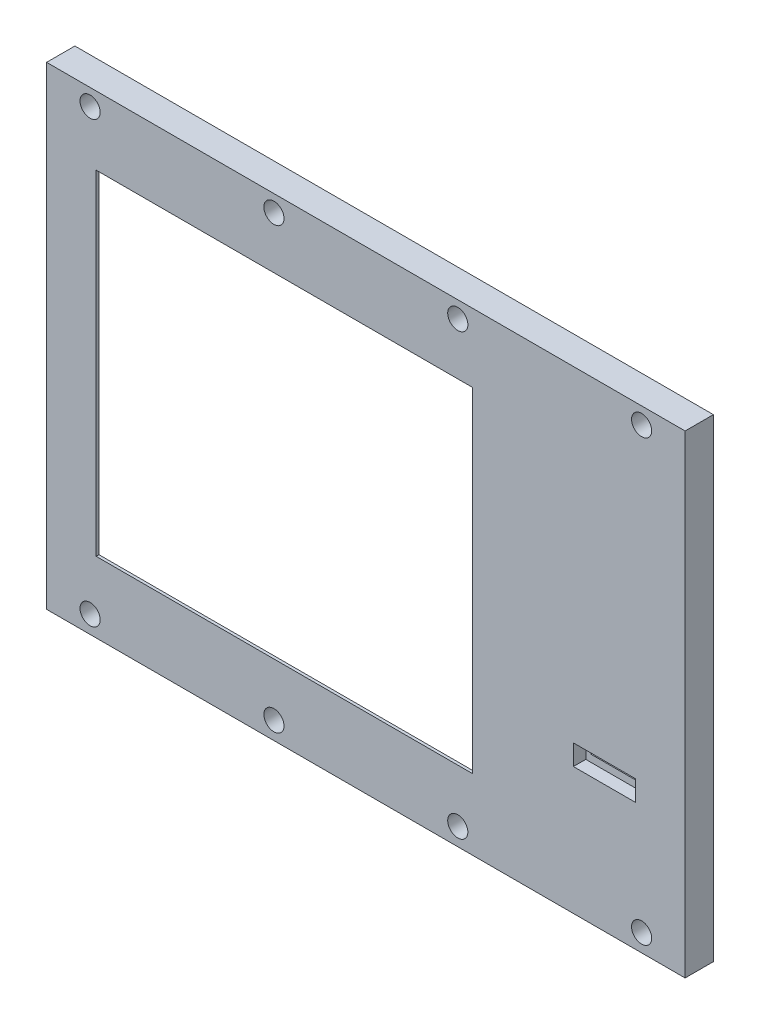
from build123d import *
from OCP.BRepFilletAPI import BRepFilletAPI_MakeChamfer

# Parameters (mm, degrees)
SKETCH1_W               = 180.6
SKETCH1_H               = 134
BOSS_EXTRUDE1_DEPTH     = 0.8
SKETCH1_3_W             = 180.6
SKETCH1_3_H             = 134
SKETCH1_3_W_2           = 172.6
SKETCH1_3_H_2           = 114.6
BOSS_EXTRUDE2_DEPTH     = 16
BOSS_EXTRUDE3_START     = 15.2
BOSS_EXTRUDE3_OUTLINE_W = 172.6
BOSS_EXTRUDE3_OUTLINE_H = 114.6
BOSS_EXTRUDE3_DEPTH     = 0.8
SKETCH2_R               = 1.75
CUT_EXTRUDE1_DEPTH      = 262.731099587
SKETCH3_R               = 2.85
CUT_EXTRUDE2_DEPTH      = 5.8
SKETCH6_R               = 3.95
BOSS_EXTRUDE4_DEPTH     = 3
SKETCH6_3_R             = 3.95
BOSS_EXTRUDE5_DEPTH     = 0.5
SKETCH7_R               = 3.95
BOSS_EXTRUDE6_DEPTH     = 2.5
SKETCH8_R               = 2.5
CUT_EXTRUDE3_DEPTH      = 4
CUT_EXTRUDE4_DEPTH      = 262.683412716
SKETCH9_W               = 17.6
SKETCH9_H               = 5.8
CUT_EXTRUDE5_DEPTH      = 262.683412716
BOSS_EXTRUDE7_START     = -0.8
SKETCH10_W              = 17.6
SKETCH10_H              = 5.8
BOSS_EXTRUDE7_DEPTH     = 4.5
BOSS_EXTRUDE11_START    = -0.8
SKETCH10_4_W            = 1.5
SKETCH10_4_H            = 10
SKETCH10_4_W_2          = 12
SKETCH10_4_H_2          = 1.5
BOSS_EXTRUDE11_DEPTH    = 4.5
SKETCH12_W              = 17.6
SKETCH12_H              = 5.8
SKETCH12_W_2            = 14.6
SKETCH12_H_2            = 2.8
BOSS_EXTRUDE12_DEPTH    = 1
CHAMFER1_SIZE           = 3.7
CHAMFER1_SIZE_2         = 10
FILLET1_R               = 1.5
SKETCH13_W              = 106.5
SKETCH13_H              = 94.6
CUT_EXTRUDE6_DEPTH      = 262.340789948


with BuildPart() as part:
    # Sketch1 → Boss-Extrude1 (new body)
    with BuildSketch(Plane.XY):
        with Locations((162, 0.763400821)):
            Rectangle(SKETCH1_W, SKETCH1_H)
    extrude(amount=BOSS_EXTRUDE1_DEPTH)

    # Sketch1<3> → Boss-Extrude2 (add)
    with BuildSketch(Plane.XY):
        with Locations((162, 0.763400821)):
            Rectangle(SKETCH1_3_W, SKETCH1_3_H)
        with Locations((162, 1.063400821)):
            Rectangle(SKETCH1_3_W_2, SKETCH1_3_H_2, mode=Mode.SUBTRACT)
    extrude(amount=BOSS_EXTRUDE2_DEPTH)

    # Boss-Extrude3: read off the stored shape, not the designer's step
    # Boss-Extrude3 outline → Boss-Extrude3 (add)
    with BuildSketch(Plane.XY.offset(BOSS_EXTRUDE3_START)):
        with Locations((162, 1.063400821)):
            Rectangle(BOSS_EXTRUDE3_OUTLINE_W, BOSS_EXTRUDE3_OUTLINE_H)
    extrude(amount=BOSS_EXTRUDE3_DEPTH)

    # Sketch2 → Cut-Extrude1 (cut, through all)
    with BuildSketch(Plane(origin=(0, 0, 0), x_dir=(-1, 0, 0), z_dir=(0, 0, -1))):
        with Locations((-84, -61.236599179)):
            Circle(SKETCH2_R)
        with Locations((-136, -61.236599179)):
            Circle(SKETCH2_R)
        with Locations((-188, -61.236599179)):
            Circle(SKETCH2_R)
        with Locations((-240, -61.236599179)):
            Circle(SKETCH2_R)
        with Locations((-84, 63.063400821)):
            Circle(SKETCH2_R)
        with Locations((-136, 63.063400821)):
            Circle(SKETCH2_R)
        with Locations((-188, 63.063400821)):
            Circle(SKETCH2_R)
        with Locations((-240, 63.063400821)):
            Circle(SKETCH2_R)
    extrude(amount=-CUT_EXTRUDE1_DEPTH, mode=Mode.SUBTRACT)

    # Sketch3 → Cut-Extrude2 (cut)
    with BuildSketch(Plane.XY.offset(16)):
        with Locations((84, -61.236599179)):
            Circle(SKETCH3_R)
        with Locations((136, -61.236599179)):
            Circle(SKETCH3_R)
        with Locations((188, -61.236599179)):
            Circle(SKETCH3_R)
        with Locations((240, -61.236599179)):
            Circle(SKETCH3_R)
        with Locations((240, 63.063400821)):
            Circle(SKETCH3_R)
        with Locations((188, 63.063400821)):
            Circle(SKETCH3_R)
        with Locations((136, 63.063400821)):
            Circle(SKETCH3_R)
        with Locations((84, 63.063400821)):
            Circle(SKETCH3_R)
    extrude(amount=-CUT_EXTRUDE2_DEPTH, mode=Mode.SUBTRACT)

    # Sketch6 → Boss-Extrude4 (add)
    # profile 1 of 4: a face of its own
    with BuildSketch(Plane.XY.offset(0.8)):
        with Locations((88.75, 36.95)):
            Circle(SKETCH6_R)
        Polygon((91.5, 35.36228676), (91.5, 38.53771324), (88.75, 40.125426481), (86, 38.53771324), (86, 35.36228676), (88.75, 33.774573519), align=None, mode=Mode.SUBTRACT)
    # profile 2 of 4: a face of its own
    with BuildSketch(Plane.XY.offset(0.8)):
        with Locations((88.75, -36.95)):
            Circle(SKETCH6_R)
        Polygon((91.5, -35.36228676), (88.75, -33.774573519), (86, -35.36228676), (86, -38.53771324), (88.75, -40.125426481), (91.5, -38.53771324), align=None, mode=Mode.SUBTRACT)
    # profile 3 of 4: a face of its own
    with BuildSketch(Plane.XY.offset(0.8)):
        with Locations((202.65, -36.95)):
            Circle(SKETCH6_R)
        Polygon((205.4, -38.53771324), (205.4, -35.36228676), (202.65, -33.774573519), (199.9, -35.36228676), (199.9, -38.53771324), (202.65, -40.125426481), align=None, mode=Mode.SUBTRACT)
    # profile 4 of 4: a face of its own
    with BuildSketch(Plane.XY.offset(0.8)):
        with Locations((202.65, 36.95)):
            Circle(SKETCH6_R)
        Polygon((205.4, 35.36228676), (205.4, 38.53771324), (202.65, 40.125426481), (199.9, 38.53771324), (199.9, 35.36228676), (202.65, 33.774573519), align=None, mode=Mode.SUBTRACT)
    extrude(amount=BOSS_EXTRUDE4_DEPTH)

    # Sketch6<3> → Boss-Extrude5 (add)
    with BuildSketch(Plane.XY.offset(0.8)):
        Polygon((86, 35.36228676), (88.75, 33.774573519), (91.5, 35.36228676), (91.5, 38.53771324), (88.75, 40.125426481), (86, 38.53771324), align=None)
        Polygon((199.9, 35.36228676), (202.65, 33.774573519), (205.4, 35.36228676), (205.4, 38.53771324), (202.65, 40.125426481), (199.9, 38.53771324), align=None)
        Polygon((199.9, -38.53771324), (202.65, -40.125426481), (205.4, -38.53771324), (205.4, -35.36228676), (202.65, -33.774573519), (199.9, -35.36228676), align=None)
        Polygon((88.75, -40.125426481), (91.5, -38.53771324), (91.5, -35.36228676), (88.75, -33.774573519), (86, -35.36228676), (86, -38.53771324), align=None)
        with Locations((88.75, 36.95)):
            Circle(SKETCH6_3_R)
    extrude(amount=BOSS_EXTRUDE5_DEPTH)

    # Sketch7 → Boss-Extrude6 (add)
    # profile 1 of 2: a face of its own
    with BuildSketch(Plane.XY.offset(0.8)):
        with Locations((218.5, 4)):
            Circle(SKETCH7_R)
        Polygon((220.08771324, 6.75), (216.91228676, 6.75), (215.324573519, 4), (216.91228676, 1.25), (220.08771324, 1.25), (221.675426481, 4), align=None, mode=Mode.SUBTRACT)
    # profile 2 of 2: a face of its own
    with BuildSketch(Plane.XY.offset(0.8)):
        with Locations((233.4, 33.2)):
            Circle(SKETCH7_R)
        Polygon((234.98771324, 35.95), (231.81228676, 35.95), (230.224573519, 33.2), (231.81228676, 30.45), (234.98771324, 30.45), (236.575426481, 33.2), align=None, mode=Mode.SUBTRACT)
    extrude(amount=BOSS_EXTRUDE6_DEPTH)

    # Sketch8 → Cut-Extrude3 (cut)
    with BuildSketch(Plane.ZY.offset(-71.7)):
        with Locations(Location((8, 0, 0), (0, 0, 270))):
            Circle(SKETCH8_R)
    extrude(amount=-CUT_EXTRUDE3_DEPTH, mode=Mode.SUBTRACT)

    # Sketch4 → Cut-Extrude4 (cut, through all)
    with BuildSketch(Plane.XY.offset(0.8)):
        with BuildLine():
            Line((188.3, -41.236599179), (178.3, -41.236599179))
            ThreePointArc((178.3, -41.236599179), (173.3, -46.236599179), (178.3, -51.236599179))
            Line((178.3, -51.236599179), (188.3, -51.236599179))
            ThreePointArc((188.3, -51.236599179), (193.3, -46.236599179), (188.3, -41.236599179))
        make_face()
    extrude(amount=-CUT_EXTRUDE4_DEPTH, mode=Mode.SUBTRACT)

    # Sketch9 → Cut-Extrude5 (cut, through all)
    with BuildSketch(Plane(origin=(0, 0, 15.2), x_dir=(-1, 0, 0), z_dir=(0, 0, -1))):
        with Locations((-229.5, -27.336599179)):
            Rectangle(SKETCH9_W, SKETCH9_H)
    extrude(amount=-CUT_EXTRUDE5_DEPTH, mode=Mode.SUBTRACT)

    # Sketch10 → Boss-Extrude7 (add)
    with BuildSketch(Plane(origin=(0, 0, 15.2), x_dir=(-1, 0, 0), z_dir=(0, 0, -1)).offset(BOSS_EXTRUDE7_START)):
        Polygon((-220.7, -31.736599179), (-219.2, -31.736599179), (-219.2, -30.236599179), (-219.2, -24.436599179), (-219.2, -22.936599179), (-220.7, -22.936599179), (-227.795416498, -22.936599179), (-229.295416498, -22.936599179), (-237.890832997, -22.936599179), (-248.3, -18.489964731), (-248.3, -20.121097705), (-239.8, -23.752165666), (-239.8, -30.921032692), (-248.3, -34.552100653), (-248.3, -36.183233627), (-237.890832997, -31.736599179), (-229.295416498, -31.736599179), (-227.795416498, -31.736599179), align=None)
        with Locations((-229.5, -27.336599179)):
            Rectangle(SKETCH10_W, SKETCH10_H, mode=Mode.SUBTRACT)
    extrude(amount=BOSS_EXTRUDE7_DEPTH)

    # Sketch10<4> → Boss-Extrude11 (add)
    with BuildSketch(Plane(origin=(0, 0, 15.2), x_dir=(-1, 0, 0), z_dir=(0, 0, -1)).offset(BOSS_EXTRUDE11_START)):
        with Locations((-228.545416498, -17.936599179)):
            Rectangle(SKETCH10_4_W, SKETCH10_4_H)
        with Locations((-219.95, -17.936599179)):
            Rectangle(SKETCH10_4_W, SKETCH10_4_H)
        with Locations((-228.545416498, -36.736599179)):
            Rectangle(SKETCH10_4_W, SKETCH10_4_H)
        with Locations((-219.95, -36.736599179)):
            Rectangle(SKETCH10_4_W, SKETCH10_4_H)
        with Locations((-213.2, -30.986599179)):
            Rectangle(SKETCH10_4_W_2, SKETCH10_4_H_2)
        with Locations((-213.2, -23.686599179)):
            Rectangle(SKETCH10_4_W_2, SKETCH10_4_H_2)
    extrude(amount=BOSS_EXTRUDE11_DEPTH)

    # Sketch12 → Boss-Extrude12 (add)
    with BuildSketch(Plane(origin=(0, 0, 11.5), x_dir=(-1, 0, 0), z_dir=(0, 0, -1))):
        with Locations((-229.5, -27.336599179)):
            Rectangle(SKETCH12_W, SKETCH12_H)
        with Locations((-229.5, -26.836599179)):
            Rectangle(SKETCH12_W_2, SKETCH12_H_2, mode=Mode.SUBTRACT)
    extrude(amount=-BOSS_EXTRUDE12_DEPTH)

    # Chamfer1
    chamfer1_edges_1 = [part.edges().sort_by_distance(p)[0] for p in [
        (228.545416498, -12.936599179, 11.5),
    ]]
    chamfer1_side_1 = [part.faces().sort_by_distance(p)[0] for p in [
        (228.545416498, -12.936599179, 11.574),
    ]]
    chamfer1_edges_2 = [part.edges().sort_by_distance(p)[0] for p in [
        (219.95, -12.936599179, 11.5),
    ]]
    chamfer1_side_2 = [part.faces().sort_by_distance(p)[0] for p in [
        (219.95, -12.936599179, 11.574),
    ]]
    chamfer1_edges_3 = [part.edges().sort_by_distance(p)[0] for p in [
        (207.2, -23.686599179, 11.5),
    ]]
    chamfer1_side_3 = [part.faces().sort_by_distance(p)[0] for p in [
        (207.2, -23.686599179, 11.574),
    ]]
    chamfer1_edges_4 = [part.edges().sort_by_distance(p)[0] for p in [
        (207.2, -30.986599179, 11.5),
    ]]
    chamfer1_side_4 = [part.faces().sort_by_distance(p)[0] for p in [
        (207.2, -30.986599179, 11.574),
    ]]
    chamfer1_edges_5 = [part.edges().sort_by_distance(p)[0] for p in [
        (219.95, -41.736599179, 11.5),
    ]]
    chamfer1_side_5 = [part.faces().sort_by_distance(p)[0] for p in [
        (219.95, -41.736599179, 11.574),
    ]]
    chamfer1_edges_6 = [part.edges().sort_by_distance(p)[0] for p in [
        (228.545416498, -41.736599179, 11.5),
    ]]
    chamfer1_side_6 = [part.faces().sort_by_distance(p)[0] for p in [
        (228.545416498, -41.736599179, 11.574),
    ]]
    chamfer1 = BRepFilletAPI_MakeChamfer(part.part.solid().wrapped)
    for e in chamfer1_edges_1:
        chamfer1.Add(CHAMFER1_SIZE - 0.0001, CHAMFER1_SIZE_2 - 0.0001, e.wrapped, chamfer1_side_1[0].wrapped)
    for e in chamfer1_edges_2:
        chamfer1.Add(CHAMFER1_SIZE - 0.0001, CHAMFER1_SIZE_2 - 0.0001, e.wrapped, chamfer1_side_2[0].wrapped)
    for e in chamfer1_edges_3:
        chamfer1.Add(CHAMFER1_SIZE - 0.0001, CHAMFER1_SIZE_2 - 0.0001, e.wrapped, chamfer1_side_3[0].wrapped)
    for e in chamfer1_edges_4:
        chamfer1.Add(CHAMFER1_SIZE - 0.0001, CHAMFER1_SIZE_2 - 0.0001, e.wrapped, chamfer1_side_4[0].wrapped)
    for e in chamfer1_edges_5:
        chamfer1.Add(CHAMFER1_SIZE - 0.0001, CHAMFER1_SIZE_2 - 0.0001, e.wrapped, chamfer1_side_5[0].wrapped)
    for e in chamfer1_edges_6:
        chamfer1.Add(CHAMFER1_SIZE - 0.0001, CHAMFER1_SIZE_2 - 0.0001, e.wrapped, chamfer1_side_6[0].wrapped)
    add(Compound.cast(chamfer1.Shape()), mode=Mode.REPLACE)  # a hair under: the kernel refuses the full size

    # Fillet1
    # the kernel refuses this fillet: 1.5 mm, written as the material it adds along each edge
    with BuildSketch(Plane(origin=(246.8, -32.28019098, 13.7), x_dir=(-0.39284148462788226, -0.9196062026516358, 0), z_dir=(0, 0, 1))) as fillet1_piece_1_section:
        Polygon((0, 0), (FILLET1_R * 1.02, 0), (FILLET1_R * 1.02, FILLET1_R * 1.54489857748), (-FILLET1_R * 0.40069831432, FILLET1_R * 0.937998326705), align=None)
    fillet1_piece_1 = extrude(amount=FILLET1_R * 1.02, mode=Mode.PRIVATE)
    fillet1_piece_1 = fillet1_piece_1 - Plane(origin=(246.8, -32.28019098, 13.7), x_dir=(-0.5509802697792897, 0.8345182696106427, 0), z_dir=(0, 0, 1)) * Sphere(FILLET1_R, mode=Mode.PRIVATE)
    add(fillet1_piece_1)
    with BuildSketch(Plane(origin=(246.8, -22.393007377, 13.7), x_dir=(-0.39284148462788226, 0.9196062026516358, 0), z_dir=(0, 0, 1))) as fillet1_piece_2_section:
        Polygon((0, 0), (FILLET1_R * 1.02, 0), (FILLET1_R * 1.02, -FILLET1_R * 1.54489857748), (-FILLET1_R * 0.40069831432, -FILLET1_R * 0.937998326705), align=None)
    fillet1_piece_2 = extrude(amount=FILLET1_R * 1.02, mode=Mode.PRIVATE)
    fillet1_piece_2 = fillet1_piece_2 - Plane(origin=(246.8, -22.393007377, 13.7), x_dir=(-0.5509802697792897, -0.8345182696106427, 0), z_dir=(0, 0, 1)) * Sphere(FILLET1_R, mode=Mode.PRIVATE)
    add(fillet1_piece_2)
    with BuildSketch(Plane(origin=(237.583862626, -21.436599179, 13.7), x_dir=(0.39284148462788177, -0.919606202651636, 0), z_dir=(0, 0, 1))) as fillet1_piece_3_section:
        Polygon((0, 0), (FILLET1_R * 1.02, 0), (FILLET1_R * 1.02, -FILLET1_R * 0.208739851834), (FILLET1_R * 0.937998326705, -FILLET1_R * 0.40069831432), align=None)
    fillet1_piece_3 = extrude(amount=FILLET1_R * 1.02, mode=Mode.PRIVATE)
    fillet1_piece_3 = fillet1_piece_3 - Plane(origin=(237.583862626, -21.436599179, 13.7), x_dir=(-0.20049164240481954, 0.9796954125266781, 0), z_dir=(0, 0, 1)) * Sphere(FILLET1_R, mode=Mode.PRIVATE)
    add(fillet1_piece_3)
    with BuildSketch(Plane(origin=(237.583862626, -33.236599179, 13.7), x_dir=(0, 1, 0), z_dir=(0, 0, 1))) as fillet1_piece_4_section:
        Polygon((0, 0), (FILLET1_R * 1.02, 0), (FILLET1_R * 1.02, -FILLET1_R * 0.208739851834), (FILLET1_R * 0.937998326705, -FILLET1_R * 0.40069831432), align=None)
    fillet1_piece_4 = extrude(amount=FILLET1_R * 1.02, mode=Mode.PRIVATE)
    fillet1_piece_4 = fillet1_piece_4 - Plane(origin=(237.583862626, -33.236599179, 13.7), x_dir=(-0.2004916424048197, -0.9796954125266781, 0), z_dir=(0, 0, 1)) * Sphere(FILLET1_R, mode=Mode.PRIVATE)
    add(fillet1_piece_4)
    with BuildSketch(Plane(origin=(248.3, -14.739964731, 11.5), x_dir=(-1, 0, 0), z_dir=(0, -1, 0))) as fillet1_piece_5_section:
        with BuildLine():
            CenterArc((FILLET1_R, FILLET1_R), FILLET1_R, 180, 90)
            Line((0, FILLET1_R), (0, 0))
            Line((0, 0), (FILLET1_R, 0))
        make_face()
    fillet1_piece_5 = extrude(amount=9.131132974, mode=Mode.PRIVATE)
    fillet1_piece_5 = split(fillet1_piece_5, bisect_by=Plane(origin=(250.243985224, -19.290657415, 11.5), z_dir=(-0.39284148462788226, 0.9196062026516358, 0)), keep=Keep.TOP, mode=Mode.PRIVATE)
    fillet1_piece_5 = split(fillet1_piece_5, bisect_by=Plane(origin=(249.654722997, -17.911248111, 11.5), z_dir=(0.39284148462788177, -0.919606202651636, 0)), keep=Keep.TOP, mode=Mode.PRIVATE)
    add(fillet1_piece_5)
    with BuildSketch(Plane(origin=(248.3, -30.802100653, 11.5), x_dir=(-1, 0, 0), z_dir=(0, -1, 0))) as fillet1_piece_6_section:
        with BuildLine():
            CenterArc((FILLET1_R, FILLET1_R), FILLET1_R, 180, 90)
            Line((0, FILLET1_R), (0, 0))
            Line((0, 0), (FILLET1_R, 0))
        make_face()
    fillet1_piece_6 = extrude(amount=9.131132974, mode=Mode.PRIVATE)
    fillet1_piece_6 = split(fillet1_piece_6, bisect_by=Plane(origin=(246.356014776, -35.352793337, 11.5), z_dir=(0.3928414846278821, 0.919606202651636, 0)), keep=Keep.TOP, mode=Mode.PRIVATE)
    fillet1_piece_6 = split(fillet1_piece_6, bisect_by=Plane(origin=(246.945277003, -33.973384033, 11.5), z_dir=(-0.39284148462788226, -0.9196062026516358, 0)), keep=Keep.TOP, mode=Mode.PRIVATE)
    add(fillet1_piece_6)
    with BuildSketch(Plane(origin=(248.3, -36.183233627, 17.675890687), x_dir=(-0.9196062026516343, 0.39284148462788554, 0), z_dir=(0, 0, -1))) as fillet1_piece_7_section:
        with BuildLine():
            CenterArc((FILLET1_R * 0.660237516473, -FILLET1_R), FILLET1_R, 90, 66.868579185)
            Line((-FILLET1_R * 0.259368686178, -FILLET1_R * 0.607158515372), (0, 0))
            Line((0, 0), (FILLET1_R * 0.660237516473, 0))
        make_face()
    fillet1_piece_7 = extrude(amount=6.175890687, mode=Mode.PRIVATE)
    fillet1_piece_7 = split(fillet1_piece_7, bisect_by=Plane(origin=(248.3, -36.183233627, 16), z_dir=(0, 0, -1)), keep=Keep.TOP, mode=Mode.PRIVATE)
    add(fillet1_piece_7)
    with BuildSketch(Plane(origin=(248.3, -32.28019098, 15.2), x_dir=(0, 0, -1), z_dir=(0, 1, 0))) as fillet1_piece_8:
        with BuildLine():
            CenterArc((FILLET1_R, FILLET1_R), FILLET1_R, 180, 90)
            Line((0, FILLET1_R), (0, 0))
            Line((0, 0), (FILLET1_R, 0))
        make_face()
    extrude(amount=9.887183603)
    with BuildSketch(Plane(origin=(248.3, -20.121097705, 13.7), x_dir=(0, -1, 0), z_dir=(0, 0, -1))) as fillet1_piece_9:
        with BuildLine():
            CenterArc((FILLET1_R * 1.51460644851, FILLET1_R), FILLET1_R, 156.868579185, 113.131420815)
            Line((FILLET1_R * 0.59500024586, FILLET1_R * 1.39284148463), (0, 0))
            Line((0, 0), (FILLET1_R * 1.51460644851, 0))
        make_face()
    extrude(amount=2.2)
    with BuildSketch(Plane(origin=(246.210737773, -21.013598073, 15.2), x_dir=(0, 0, -1), z_dir=(-0.9196062026516358, -0.39284148462788226, 0))) as fillet1_piece_10_section:
        with BuildLine():
            CenterArc((FILLET1_R, FILLET1_R), FILLET1_R, 180, 90)
            Line((0, FILLET1_R), (0, 0))
            Line((0, 0), (FILLET1_R, 0))
        make_face()
    fillet1_piece_10 = extrude(amount=10.721177178, mode=Mode.PRIVATE)
    fillet1_piece_10 = split(fillet1_piece_10, bisect_by=Plane(origin=(238.3, -21.013598073, 15.2), z_dir=(1, 0, 0)), keep=Keep.TOP, mode=Mode.PRIVATE)
    add(fillet1_piece_10)
    with BuildSketch(Plane(origin=(239.8, -20.002165666, 15.2), x_dir=(0, 0, -1), z_dir=(0, -1, 0))) as fillet1_piece_11_section:
        with BuildLine():
            CenterArc((FILLET1_R, FILLET1_R), FILLET1_R, 180, 90)
            Line((0, FILLET1_R), (0, 0))
            Line((0, 0), (FILLET1_R, 0))
        make_face()
    fillet1_piece_11 = extrude(amount=14.668867026, mode=Mode.PRIVATE)
    fillet1_piece_11 = split(fillet1_piece_11, bisect_by=Plane(origin=(235.85545593, -29.23598474, 15.2), z_dir=(0.39284148462788226, 0.9196062026516358, 0)), keep=Keep.TOP, mode=Mode.PRIVATE)
    fillet1_piece_11 = split(fillet1_piece_11, bisect_by=Plane(origin=(240.56546077, -21.794039742, 15.2), z_dir=(0.39284148462788177, -0.919606202651636, 0)), keep=Keep.TOP, mode=Mode.PRIVATE)
    add(fillet1_piece_11)
    with BuildSketch(Plane(origin=(248.3, -34.552100653, 13.7), x_dir=(0, 1, 0), z_dir=(0, 0, -1))) as fillet1_piece_12:
        with BuildLine():
            CenterArc((FILLET1_R * 1.51460644851, -FILLET1_R), FILLET1_R, 90, 113.131420815)
            Line((FILLET1_R * 0.59500024586, -FILLET1_R * 1.39284148463), (0, 0))
            Line((0, 0), (FILLET1_R * 1.51460644851, 0))
        make_face()
    extrude(amount=2.2)
    with BuildSketch(Plane(origin=(236.35147674, -29.447877125, 15.2), x_dir=(0, 0, -1), z_dir=(0.9196062026516358, -0.39284148462788226, 0))) as fillet1_piece_13_section:
        with BuildLine():
            CenterArc((FILLET1_R, FILLET1_R), FILLET1_R, 180, 90)
            Line((0, FILLET1_R), (0, 0))
            Line((0, 0), (FILLET1_R, 0))
        make_face()
    fillet1_piece_13 = extrude(amount=10.721177178, mode=Mode.PRIVATE)
    fillet1_piece_13 = split(fillet1_piece_13, bisect_by=Plane(origin=(238.3, -29.447877125, 15.2), z_dir=(1, 0, 0)), keep=Keep.TOP, mode=Mode.PRIVATE)
    add(fillet1_piece_13)
    with BuildSketch(Plane(origin=(248.3, -18.489964731, 17.675890687), x_dir=(0, 1, 0), z_dir=(0, 0, -1))) as fillet1_piece_14_section:
        with BuildLine():
            CenterArc((FILLET1_R * 0.660237516473, -FILLET1_R), FILLET1_R, 90, 66.868579185)
            Line((-FILLET1_R * 0.259368686178, -FILLET1_R * 0.607158515372), (0, 0))
            Line((0, 0), (FILLET1_R * 0.660237516473, 0))
        make_face()
    fillet1_piece_14 = extrude(amount=6.175890687, mode=Mode.PRIVATE)
    fillet1_piece_14 = split(fillet1_piece_14, bisect_by=Plane(origin=(248.3, -18.489964731, 16), z_dir=(0, 0, -1)), keep=Keep.TOP, mode=Mode.PRIVATE)
    add(fillet1_piece_14)
    with BuildSketch(Plane(origin=(238.173124853, -22.816008483, 15.2), x_dir=(-0.39284148462788177, 0.919606202651636, 0), z_dir=(0.919606202651636, 0.39284148462788177, 0)), Plane(origin=(251.74852326, -37.656389194, 15.2), x_dir=(-0.3928414846278821, -0.9196062026516357, 0), z_dir=(-0.919606202651636, 0.3928414846278821, 0))) as fillet1_piece_15:
        with BuildLine():
            CenterArc((FILLET1_R, -FILLET1_R), FILLET1_R, 90, 90)
            Line((0, -FILLET1_R), (0, 0))
            Line((0, 0), (FILLET1_R, 0))
        make_face()
    extrude(amount=14.762186649)
    with BuildSketch(Plane(origin=(237.890832997, -22.936599179, 13.7), x_dir=(-1, 0, 0), z_dir=(0, 0, -1))) as fillet1_piece_16:
        with BuildLine():
            CenterArc((FILLET1_R * 0.204646913562, FILLET1_R), FILLET1_R, 246.868579185, 23.131420815)
            Line((-FILLET1_R * 0.188194571065, FILLET1_R * 0.0803937973484), (0, 0))
            Line((0, 0), (FILLET1_R * 0.204646913562, 0))
        make_face()
    extrude(amount=2.2)
    with BuildSketch(Plane(origin=(225.545416498, -22.936599179, 15.2), x_dir=(0, 0, -1), z_dir=(1, 0, 0))) as fillet1_piece_17:
        with BuildLine():
            CenterArc((FILLET1_R, FILLET1_R), FILLET1_R, 180, 90)
            Line((0, FILLET1_R), (0, 0))
            Line((0, 0), (FILLET1_R, 0))
        make_face()
    extrude(amount=12.038446128)
    with BuildSketch(Plane(origin=(229.295416498, -22.936599179, 18.95), x_dir=(0, 1, 0), z_dir=(0, 0, -1))) as fillet1_piece_18_section:
        with BuildLine():
            CenterArc((FILLET1_R, FILLET1_R), FILLET1_R, 180, 90)
            Line((0, FILLET1_R), (0, 0))
            Line((0, 0), (FILLET1_R, 0))
        make_face()
    fillet1_piece_18 = extrude(amount=7.45, mode=Mode.PRIVATE)
    fillet1_piece_18 = split(fillet1_piece_18, bisect_by=Plane(origin=(229.295416498, -20.512042879, 12.397033557), z_dir=(0, -0.3470036846710527, 0.9378637655996274)), keep=Keep.TOP, mode=Mode.PRIVATE)
    fillet1_piece_18 = split(fillet1_piece_18, bisect_by=Plane(origin=(229.295416498, -22.936599179, 16), z_dir=(0, 0, -1)), keep=Keep.TOP, mode=Mode.PRIVATE)
    add(fillet1_piece_18)
    with BuildSketch(Plane(origin=(227.795416498, -22.936599179, 18.95), x_dir=(-1, 0, 0), z_dir=(0, 0, -1))) as fillet1_piece_19_section:
        with BuildLine():
            CenterArc((FILLET1_R, FILLET1_R), FILLET1_R, 180, 90)
            Line((0, FILLET1_R), (0, 0))
            Line((0, 0), (FILLET1_R, 0))
        make_face()
    fillet1_piece_19 = extrude(amount=7.45, mode=Mode.PRIVATE)
    fillet1_piece_19 = split(fillet1_piece_19, bisect_by=Plane(origin=(227.795416498, -20.512042879, 12.397033557), z_dir=(0, -0.3470036846710527, 0.9378637655996274)), keep=Keep.TOP, mode=Mode.PRIVATE)
    fillet1_piece_19 = split(fillet1_piece_19, bisect_by=Plane(origin=(227.795416498, -22.936599179, 16), z_dir=(0, 0, -1)), keep=Keep.TOP, mode=Mode.PRIVATE)
    add(fillet1_piece_19)
    with BuildSketch(Plane(origin=(220.7, -22.936599179, 15.2), x_dir=(0, 1, 0), z_dir=(1, 0, 0))) as fillet1_piece_20:
        with BuildLine():
            CenterArc((FILLET1_R, -FILLET1_R), FILLET1_R, 90, 90)
            Line((0, -FILLET1_R), (0, 0))
            Line((0, 0), (FILLET1_R, 0))
        make_face()
    extrude(amount=10.845416498)
    with BuildSketch(Plane(origin=(220.7, -22.936599179, 18.95), x_dir=(0, 1, 0), z_dir=(0, 0, -1))) as fillet1_piece_21_section:
        with BuildLine():
            CenterArc((FILLET1_R, FILLET1_R), FILLET1_R, 180, 90)
            Line((0, FILLET1_R), (0, 0))
            Line((0, 0), (FILLET1_R, 0))
        make_face()
    fillet1_piece_21 = extrude(amount=7.45, mode=Mode.PRIVATE)
    fillet1_piece_21 = split(fillet1_piece_21, bisect_by=Plane(origin=(220.7, -20.512042879, 12.397033557), z_dir=(0, -0.34700368467105286, 0.9378637655996273)), keep=Keep.TOP, mode=Mode.PRIVATE)
    fillet1_piece_21 = split(fillet1_piece_21, bisect_by=Plane(origin=(220.7, -22.936599179, 16), z_dir=(0, 0, -1)), keep=Keep.TOP, mode=Mode.PRIVATE)
    add(fillet1_piece_21)
    with BuildSketch(Plane(origin=(219.2, -22.936599179, 18.95), x_dir=(-1, 0, 0), z_dir=(0, 0, -1))) as fillet1_piece_22_section:
        with BuildLine():
            CenterArc((FILLET1_R, FILLET1_R), FILLET1_R, 180, 90)
            Line((0, FILLET1_R), (0, 0))
            Line((0, 0), (FILLET1_R, 0))
        make_face()
    fillet1_piece_22 = extrude(amount=7.45, mode=Mode.PRIVATE)
    fillet1_piece_22 = split(fillet1_piece_22, bisect_by=Plane(origin=(219.2, -20.512042879, 12.397033557), z_dir=(0, -0.34700368467105286, 0.9378637655996273)), keep=Keep.TOP, mode=Mode.PRIVATE)
    fillet1_piece_22 = split(fillet1_piece_22, bisect_by=Plane(origin=(219.2, -22.936599179, 16), z_dir=(0, 0, -1)), keep=Keep.TOP, mode=Mode.PRIVATE)
    add(fillet1_piece_22)
    with BuildSketch(Plane(origin=(219.2, -24.436599179, 18.95), x_dir=(0, -1, 0), z_dir=(0, 0, -1))) as fillet1_piece_23_section:
        with BuildLine():
            CenterArc((FILLET1_R, FILLET1_R), FILLET1_R, 180, 90)
            Line((0, FILLET1_R), (0, 0))
            Line((0, 0), (FILLET1_R, 0))
        make_face()
    fillet1_piece_23 = extrude(amount=7.45, mode=Mode.PRIVATE)
    fillet1_piece_23 = split(fillet1_piece_23, bisect_by=Plane(origin=(219.2, -24.436599179, 16), z_dir=(0, 0, -1)), keep=Keep.TOP, mode=Mode.PRIVATE)
    add(fillet1_piece_23)
    with BuildSketch(Plane(origin=(219.2, -30.236599179, 18.95), x_dir=(-1, 0, 0), z_dir=(0, 0, -1))) as fillet1_piece_24_section:
        with BuildLine():
            CenterArc((FILLET1_R, FILLET1_R), FILLET1_R, 180, 90)
            Line((0, FILLET1_R), (0, 0))
            Line((0, 0), (FILLET1_R, 0))
        make_face()
    fillet1_piece_24 = extrude(amount=7.45, mode=Mode.PRIVATE)
    fillet1_piece_24 = split(fillet1_piece_24, bisect_by=Plane(origin=(219.2, -30.236599179, 16), z_dir=(0, 0, -1)), keep=Keep.TOP, mode=Mode.PRIVATE)
    add(fillet1_piece_24)
    with BuildSketch(Plane(origin=(219.2, -31.736599179, 18.95), x_dir=(0, -1, 0), z_dir=(0, 0, -1))) as fillet1_piece_25_section:
        with BuildLine():
            CenterArc((FILLET1_R, FILLET1_R), FILLET1_R, 180, 90)
            Line((0, FILLET1_R), (0, 0))
            Line((0, 0), (FILLET1_R, 0))
        make_face()
    fillet1_piece_25 = extrude(amount=7.45, mode=Mode.PRIVATE)
    fillet1_piece_25 = split(fillet1_piece_25, bisect_by=Plane(origin=(219.2, -34.161155479, 12.397033557), z_dir=(0, 0.34700368467105275, 0.9378637655996273)), keep=Keep.TOP, mode=Mode.PRIVATE)
    fillet1_piece_25 = split(fillet1_piece_25, bisect_by=Plane(origin=(219.2, -31.736599179, 16), z_dir=(0, 0, -1)), keep=Keep.TOP, mode=Mode.PRIVATE)
    add(fillet1_piece_25)
    with BuildSketch(Plane(origin=(220.7, -31.736599179, 18.95), x_dir=(0, -1, 0), z_dir=(0, 0, -1))) as fillet1_piece_26_section:
        with BuildLine():
            CenterArc((FILLET1_R, -FILLET1_R), FILLET1_R, 90, 90)
            Line((0, -FILLET1_R), (0, 0))
            Line((0, 0), (FILLET1_R, 0))
        make_face()
    fillet1_piece_26 = extrude(amount=7.45, mode=Mode.PRIVATE)
    fillet1_piece_26 = split(fillet1_piece_26, bisect_by=Plane(origin=(220.7, -34.161155479, 12.397033557), z_dir=(0, 0.34700368467105275, 0.9378637655996273)), keep=Keep.TOP, mode=Mode.PRIVATE)
    fillet1_piece_26 = split(fillet1_piece_26, bisect_by=Plane(origin=(220.7, -31.736599179, 16), z_dir=(0, 0, -1)), keep=Keep.TOP, mode=Mode.PRIVATE)
    add(fillet1_piece_26)
    with BuildSketch(Plane(origin=(231.545416498, -31.736599179, 15.2), x_dir=(0, -1, 0), z_dir=(-1, 0, 0))) as fillet1_piece_27_section:
        with BuildLine():
            CenterArc((FILLET1_R, -FILLET1_R), FILLET1_R, 90, 90)
            Line((0, -FILLET1_R), (0, 0))
            Line((0, 0), (FILLET1_R, 0))
        make_face()
    fillet1_piece_27 = extrude(amount=14.595416498, mode=Mode.PRIVATE)
    fillet1_piece_27 = split(fillet1_piece_27, bisect_by=Plane(origin=(219.2, -31.736599179, 15.2), z_dir=(1, 0, 0)), keep=Keep.TOP, mode=Mode.PRIVATE)
    add(fillet1_piece_27)
    with BuildSketch(Plane(origin=(227.795416498, -31.736599179, 18.95), x_dir=(-1, 0, 0), z_dir=(0, 0, -1))) as fillet1_piece_28_section:
        with BuildLine():
            CenterArc((FILLET1_R, -FILLET1_R), FILLET1_R, 90, 90)
            Line((0, -FILLET1_R), (0, 0))
            Line((0, 0), (FILLET1_R, 0))
        make_face()
    fillet1_piece_28 = extrude(amount=7.45, mode=Mode.PRIVATE)
    fillet1_piece_28 = split(fillet1_piece_28, bisect_by=Plane(origin=(227.795416498, -34.161155479, 12.397033557), z_dir=(0, 0.34700368467105275, 0.9378637655996273)), keep=Keep.TOP, mode=Mode.PRIVATE)
    fillet1_piece_28 = split(fillet1_piece_28, bisect_by=Plane(origin=(227.795416498, -31.736599179, 16), z_dir=(0, 0, -1)), keep=Keep.TOP, mode=Mode.PRIVATE)
    add(fillet1_piece_28)
    with BuildSketch(Plane(origin=(229.295416498, -31.736599179, 18.95), x_dir=(0, -1, 0), z_dir=(0, 0, -1))) as fillet1_piece_29_section:
        with BuildLine():
            CenterArc((FILLET1_R, -FILLET1_R), FILLET1_R, 90, 90)
            Line((0, -FILLET1_R), (0, 0))
            Line((0, 0), (FILLET1_R, 0))
        make_face()
    fillet1_piece_29 = extrude(amount=7.45, mode=Mode.PRIVATE)
    fillet1_piece_29 = split(fillet1_piece_29, bisect_by=Plane(origin=(229.295416498, -34.161155479, 12.397033557), z_dir=(0, 0.34700368467105275, 0.9378637655996273)), keep=Keep.TOP, mode=Mode.PRIVATE)
    fillet1_piece_29 = split(fillet1_piece_29, bisect_by=Plane(origin=(229.295416498, -31.736599179, 16), z_dir=(0, 0, -1)), keep=Keep.TOP, mode=Mode.PRIVATE)
    add(fillet1_piece_29)
    with BuildSketch(Plane(origin=(237.583862626, -31.736599179, 15.2), x_dir=(0, -1, 0), z_dir=(-1, 0, 0))) as fillet1_piece_30:
        with BuildLine():
            CenterArc((FILLET1_R, -FILLET1_R), FILLET1_R, 90, 90)
            Line((0, -FILLET1_R), (0, 0))
            Line((0, 0), (FILLET1_R, 0))
        make_face()
    extrude(amount=12.038446128)
    with BuildSketch(Plane(origin=(237.890832997, -31.736599179, 13.7), x_dir=(-1, 0, 0), z_dir=(0, 0, -1))) as fillet1_piece_31:
        with BuildLine():
            CenterArc((FILLET1_R * 0.204646913562, -FILLET1_R), FILLET1_R, 90, 23.131420815)
            Line((-FILLET1_R * 0.188194571065, -FILLET1_R * 0.0803937973483), (0, 0))
            Line((0, 0), (FILLET1_R * 0.204646913562, 0))
        make_face()
    extrude(amount=2.2)
    with BuildSketch(Plane(origin=(248.3, -14.739964731, 11.5), x_dir=(-1, 0, 0), z_dir=(0, -1, 0))) as fillet1_piece_32a_section:
        with BuildLine():
            CenterArc((FILLET1_R, FILLET1_R), FILLET1_R, 180, 90)
            Line((0, FILLET1_R), (0, 0))
            Line((0, 0), (FILLET1_R, 0))
        make_face()
    fillet1_piece_32a = extrude(amount=9.131132974, mode=Mode.PRIVATE)
    fillet1_piece_32a = split(fillet1_piece_32a, bisect_by=Plane(origin=(249.654722997, -17.911248111, 11.5), z_dir=(-0.39284148462788177, 0.919606202651636, 0)), keep=Keep.TOP, mode=Mode.PRIVATE)
    with BuildSketch(Plane(origin=(248.3, -18.489964731, 15.2), x_dir=(0, 1, 0), z_dir=(0, 0, -1))) as fillet1_piece_32b_section:
        with BuildLine():
            CenterArc((FILLET1_R * 0.660237516473, -FILLET1_R), FILLET1_R, 90, 66.868579185)
            Line((-FILLET1_R * 0.259368686178, -FILLET1_R * 0.607158515372), (0, 0))
            Line((0, 0), (FILLET1_R * 0.660237516473, 0))
        make_face()
    fillet1_piece_32b = extrude(amount=6.175890687, mode=Mode.PRIVATE)
    fillet1_piece_32b = split(fillet1_piece_32b, bisect_by=Plane(origin=(248.3, -18.489964731, 11.5), z_dir=(0, 0, -1)), keep=Keep.TOP, mode=Mode.PRIVATE)
    fillet1_piece_32 = fillet1_piece_32a & fillet1_piece_32b
    add(fillet1_piece_32)
    with BuildSketch(Plane(origin=(248.3, -14.739964731, 11.5), x_dir=(-1, 0, 0), z_dir=(0, -1, 0))) as fillet1_piece_33a_section:
        with BuildLine():
            CenterArc((FILLET1_R, FILLET1_R), FILLET1_R, 180, 90)
            Line((0, FILLET1_R), (0, 0))
            Line((0, 0), (FILLET1_R, 0))
        make_face()
    fillet1_piece_33a = extrude(amount=9.131132974, mode=Mode.PRIVATE)
    fillet1_piece_33a = split(fillet1_piece_33a, bisect_by=Plane(origin=(250.243985224, -19.290657415, 11.5), z_dir=(0.39284148462788226, -0.9196062026516358, 0)), keep=Keep.TOP, mode=Mode.PRIVATE)
    with BuildSketch(Plane(origin=(248.3, -20.121097705, 13.7), x_dir=(0, -1, 0), z_dir=(0, 0, -1))) as fillet1_piece_33b_section:
        with BuildLine():
            CenterArc((FILLET1_R * 1.51460644851, FILLET1_R), FILLET1_R, 156.868579185, 113.131420815)
            Line((FILLET1_R * 0.59500024586, FILLET1_R * 1.39284148463), (0, 0))
            Line((0, 0), (FILLET1_R * 1.51460644851, 0))
        make_face()
    fillet1_piece_33b = extrude(amount=7.879774182, mode=Mode.PRIVATE)
    fillet1_piece_33b = split(fillet1_piece_33b, bisect_by=Plane(origin=(248.3, -20.121097705, 11.5), z_dir=(0, 0, -1)), keep=Keep.TOP, mode=Mode.PRIVATE)
    fillet1_piece_33 = fillet1_piece_33a & fillet1_piece_33b
    add(fillet1_piece_33)
    with BuildSketch(Plane(origin=(248.3, -30.802100653, 11.5), x_dir=(-1, 0, 0), z_dir=(0, -1, 0))) as fillet1_piece_34a_section:
        with BuildLine():
            CenterArc((FILLET1_R, FILLET1_R), FILLET1_R, 180, 90)
            Line((0, FILLET1_R), (0, 0))
            Line((0, 0), (FILLET1_R, 0))
        make_face()
    fillet1_piece_34a = extrude(amount=9.131132974, mode=Mode.PRIVATE)
    fillet1_piece_34a = split(fillet1_piece_34a, bisect_by=Plane(origin=(246.945277003, -33.973384033, 11.5), z_dir=(0.39284148462788226, 0.9196062026516358, 0)), keep=Keep.TOP, mode=Mode.PRIVATE)
    with BuildSketch(Plane(origin=(248.3, -34.552100653, 13.7), x_dir=(0, 1, 0), z_dir=(0, 0, -1))) as fillet1_piece_34b_section:
        with BuildLine():
            CenterArc((FILLET1_R * 1.51460644851, -FILLET1_R), FILLET1_R, 90, 113.131420815)
            Line((FILLET1_R * 0.59500024586, -FILLET1_R * 1.39284148463), (0, 0))
            Line((0, 0), (FILLET1_R * 1.51460644851, 0))
        make_face()
    fillet1_piece_34b = extrude(amount=7.879774182, mode=Mode.PRIVATE)
    fillet1_piece_34b = split(fillet1_piece_34b, bisect_by=Plane(origin=(248.3, -34.552100653, 11.5), z_dir=(0, 0, -1)), keep=Keep.TOP, mode=Mode.PRIVATE)
    fillet1_piece_34 = fillet1_piece_34a & fillet1_piece_34b
    add(fillet1_piece_34)
    with BuildSketch(Plane(origin=(248.3, -30.802100653, 11.5), x_dir=(-1, 0, 0), z_dir=(0, -1, 0))) as fillet1_piece_35a_section:
        with BuildLine():
            CenterArc((FILLET1_R, FILLET1_R), FILLET1_R, 180, 90)
            Line((0, FILLET1_R), (0, 0))
            Line((0, 0), (FILLET1_R, 0))
        make_face()
    fillet1_piece_35a = extrude(amount=9.131132974, mode=Mode.PRIVATE)
    fillet1_piece_35a = split(fillet1_piece_35a, bisect_by=Plane(origin=(246.356014776, -35.352793337, 11.5), z_dir=(-0.3928414846278821, -0.919606202651636, 0)), keep=Keep.TOP, mode=Mode.PRIVATE)
    with BuildSketch(Plane(origin=(248.3, -36.183233627, 15.2), x_dir=(-0.9196062026516343, 0.39284148462788554, 0), z_dir=(0, 0, -1))) as fillet1_piece_35b_section:
        with BuildLine():
            CenterArc((FILLET1_R * 0.660237516473, -FILLET1_R), FILLET1_R, 90, 66.868579185)
            Line((-FILLET1_R * 0.259368686178, -FILLET1_R * 0.607158515372), (0, 0))
            Line((0, 0), (FILLET1_R * 0.660237516473, 0))
        make_face()
    fillet1_piece_35b = extrude(amount=6.175890687, mode=Mode.PRIVATE)
    fillet1_piece_35b = split(fillet1_piece_35b, bisect_by=Plane(origin=(248.3, -36.183233627, 11.5), z_dir=(0, 0, -1)), keep=Keep.TOP, mode=Mode.PRIVATE)
    fillet1_piece_35 = fillet1_piece_35a & fillet1_piece_35b
    add(fillet1_piece_35)

    # SurfaceCut1
    split(bisect_by=Plane.XY.offset(8), keep=Keep.TOP)

    # Sketch13 → Cut-Extrude6 (cut, through all)
    with BuildSketch(Plane(origin=(0, 0, 15.2), x_dir=(-1, 0, 0), z_dir=(0, 0, -1))):
        with Locations((-138.95, 1.063400821)):
            Rectangle(SKETCH13_W, SKETCH13_H)
    extrude(amount=-CUT_EXTRUDE6_DEPTH, mode=Mode.SUBTRACT)


solid = part.part
